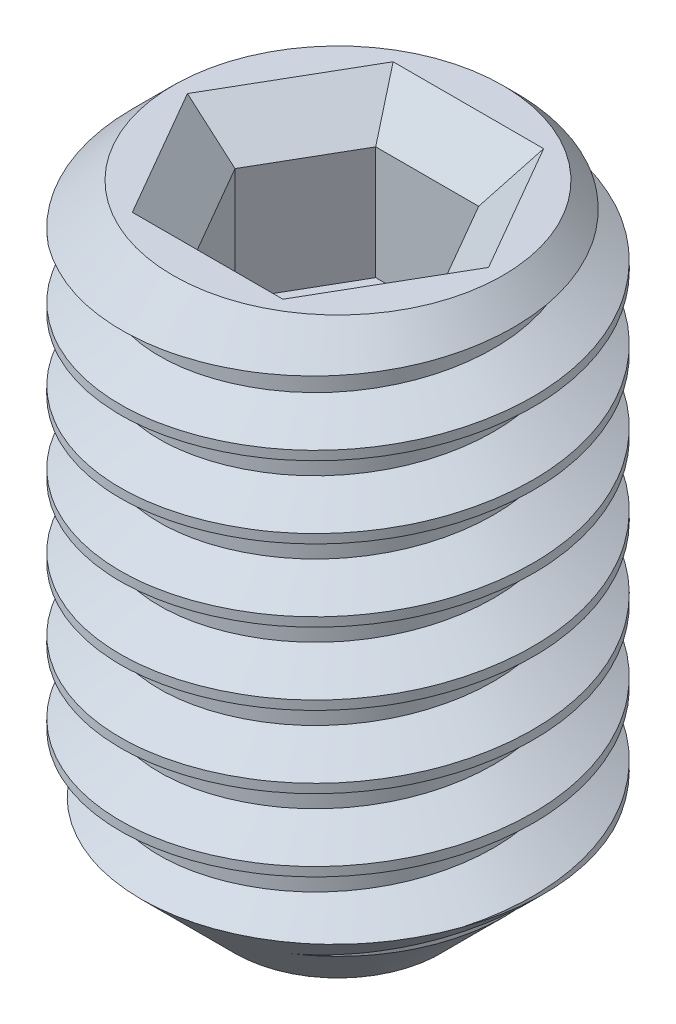
from build123d import *

# Parameters (mm, degrees)
SKETCH1_R           = 2
BOSS_EXTRUDE1_DEPTH = 6
CHAMFER1_SIZE       = 1
CHAMFER2_SIZE       = 0.4
THREAD1_PITCH       = 0.7
CUT_EXTRUDE1_DEPTH  = 1.5
CHAMFER3_SIZE       = 0.4


with BuildPart() as part:
    # Sketch1 → Boss-Extrude1 (new body)
    with BuildSketch(Plane(origin=(0, 0, 0), x_dir=(1, 0, 0), z_dir=(0, 1, 0))):
        with Locations(Location((0, 0, 0), (0, 0, 270))):
            Circle(SKETCH1_R)
    extrude(amount=BOSS_EXTRUDE1_DEPTH)

    # Chamfer1
    chamfer1_edges = [part.edges().sort_by_distance(p)[0] for p in [
        (0, 0, -2),
    ]]
    chamfer(chamfer1_edges, length=CHAMFER1_SIZE)

    # Chamfer2
    chamfer2_edges = [part.edges().sort_by_distance(p)[0] for p in [
        (0, 6, -2),
    ]]
    chamfer(chamfer2_edges, length=CHAMFER2_SIZE)

    # Thread1: arcs per turn and ends read off the stored shape
    # Thread1: the profile of Thread Profile1 profile screwed along a right-hand helix through 8.857147 turns, 6 arcs to a turn; built about Z, then put on its axis
    thread1_z = Axis((0, 0, 0), (0, 0, 1))
    thread1_corners = [(2.0003, 0, -0.000173205), (2.0003, 0, 0.612673203), (1.621113887, 0, 0.393749999), (1.621113887, 0, 0.218749999)]
    with BuildLine(mode=Mode.PRIVATE) as thread1_profile:
        Line(thread1_corners[0], thread1_corners[1])
        Line(thread1_corners[1], thread1_corners[2])
        Line(thread1_corners[2], thread1_corners[3])
        Line(thread1_corners[3], thread1_corners[0])
    thread1_cap = Face(thread1_profile.wire())
    thread1_turn_angles = [0, 30, 60, 90, 120, 150, 180, 210, 240, 270, 300, 330, 360]
    thread1_turn_weights = [1, 0.8660254037844387, 1, 0.8660254037844387, 1, 0.8660254037844387, 1, 0.8660254037844387, 1, 0.8660254037844387, 1, 0.8660254037844387, 1]
    thread1_turn_rails = [Edge.make_bspline([Vector(p[0], p[1], 0).rotate(thread1_z, thread1_turn_angles[k]) / thread1_turn_weights[k] + Vector(0, 0, p[2] + THREAD1_PITCH * thread1_turn_angles[k] / 360) for k in range(13)], [0, 0, 0, 1, 1, 2, 2, 3, 3, 4, 4, 5, 5, 6, 6, 6], 2, thread1_turn_weights) for p in thread1_corners]
    thread1_turn_sides = [Face.make_surface_from_curves(thread1_turn_rails[p[0]], thread1_turn_rails[p[1]]) for p in [(0, 1), (1, 2), (2, 3), (3, 0)]]
    thread1_last_angles = [2880, 2910, 2940, 2970, 3000, 3030, 3060, 3090, 3120, 3150, 3180, 3184.2865, 3188.573]
    thread1_last_weights = [1, 0.8660254037844387, 1, 0.8660254037844387, 1, 0.8660254037844387, 1, 0.8660254037844387, 1, 0.8660254037844387, 1, 0.9972027722911289, 1]
    thread1_last_rails = [Edge.make_bspline([Vector(p[0], p[1], 0).rotate(thread1_z, thread1_last_angles[k]) / thread1_last_weights[k] + Vector(0, 0, p[2] + THREAD1_PITCH * thread1_last_angles[k] / 360) for k in range(13)], [0, 0, 0, 1, 1, 2, 2, 3, 3, 4, 4, 5, 5, 6, 6, 6], 2, thread1_last_weights) for p in thread1_corners]
    thread1_last_sides = [Face.make_surface_from_curves(thread1_last_rails[p[0]], thread1_last_rails[p[1]]) for p in [(0, 1), (1, 2), (2, 3), (3, 0)]]
    thread1 = Plane(origin=(0, 6.2, 0), x_dir=(-1, 0, 0), z_dir=(0, -1, 0)) * Solid(Shell([*[p.moved(Location((0, 0, THREAD1_PITCH * i))) for i in range(8) for p in thread1_turn_sides], *thread1_last_sides, thread1_cap, thread1_cap.rotate(thread1_z, 3188.573).moved(Location((0, 0, THREAD1_PITCH * 3188.573 / 360)))]))
    add(thread1, mode=Mode.SUBTRACT)

    # Sketch4 → Cut-Extrude1 (cut)
    with BuildSketch(Plane(origin=(0, 6, 0), x_dir=(1, 0, 0), z_dir=(0, 1, 0))):
        Polygon((0.5, 0.866025404), (-0.5, 0.866025404), (-1, 0), (-0.5, -0.866025404), (0.5, -0.866025404), (1, 0), align=None)
    extrude(amount=-CUT_EXTRUDE1_DEPTH, mode=Mode.SUBTRACT)

    # Chamfer3
    chamfer3_edges = [part.edges().sort_by_distance(p)[0] for p in [
        (0.75, 6, -0.433012702),
        (0, 6, -0.866025404),
        (-0.75, 6, -0.433012702),
        (-0.75, 6, 0.433012702),
        (0, 6, 0.866025404),
        (0.75, 6, 0.433012702),
    ]]
    chamfer(chamfer3_edges, length=CHAMFER3_SIZE)


solid = part.part
